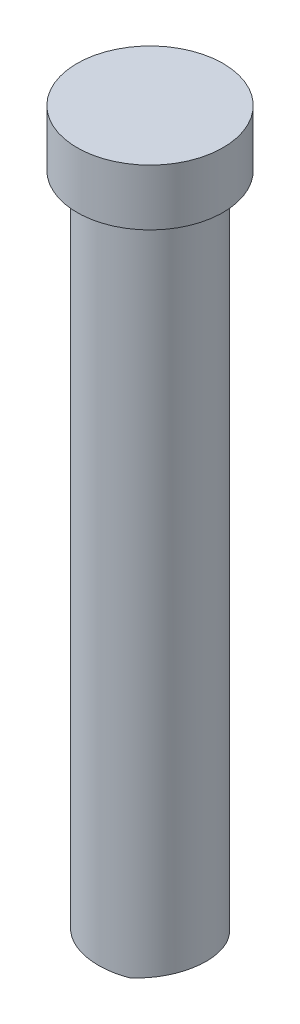
from build123d import *

# Parameters (mm, degrees)
CUT_EXTRUDE1_DEPTH = 65.854760812
CIRPATTERN1_COUNT  = 3


with BuildPart() as part:
    # Sketch1 → Revolve1 (revolve)
    with BuildSketch(Plane.XY):
        Polygon((0, 0), (6.5, 0), (6.5, -5), (5, -5), (5, -64.2), (0, -64.2), align=None)
    revolve(axis=Axis((0, -69.2, 0), (0, 1, 0)))

    # Sketch2 → Cut-Extrude1 (cut, symmetric)
    with BuildSketch(Plane.XY):
        Polygon((0, -64.2), (5, -63.497295826), (5, -64.2), align=None)
    cut_extrude1 = extrude(amount=CUT_EXTRUDE1_DEPTH, both=True, mode=Mode.SUBTRACT)

    # CirPattern1: Cut-Extrude1 ×3 about axis
    cirpattern1_axis = Axis((0, -64.2, 0), (0, -1, 0))
    for i in range(1, CIRPATTERN1_COUNT):
        add(cut_extrude1.rotate(cirpattern1_axis, i * 360 / CIRPATTERN1_COUNT), mode=Mode.SUBTRACT)


solid = part.part
